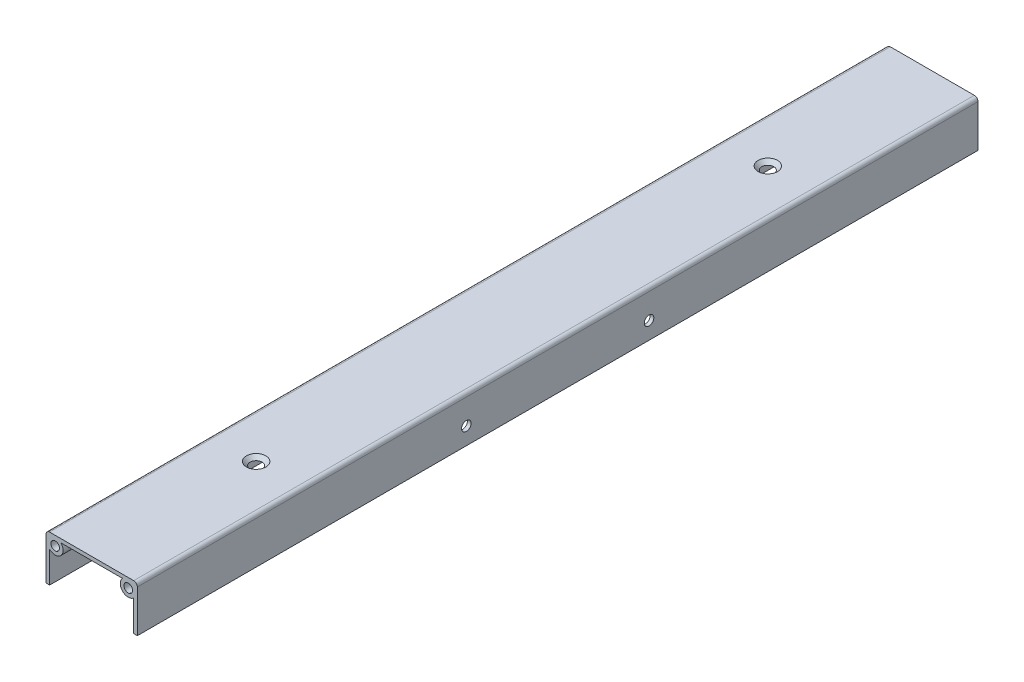
from build123d import *

# Parameters (mm, degrees)
SKETCH1_W                                            = 63.5
SKETCH1_H                                            = 63.5
SKETCH1_R                                            = 3
BOSS_EXTRUDE1_DEPTH                                  = 292.1
FILLET1_R                                            = 2.54
SHELL1_START                                         = -292.1
SHELL1_DEPTH                                         = 584.2
SKETCH3_W                                            = 63.665273771
SKETCH3_H                                            = 31.75
CUT_EXTRUDE2_DEPTH                                   = 586.923002621
CSK_FOR_M6_HEX_SOCKET_COUNTERSUNK_HEAD_S_D           = 6.4
CSK_FOR_M6_HEX_SOCKET_COUNTERSUNK_HEAD_S_CSINK_D     = 13.5
CSK_FOR_M6_HEX_SOCKET_COUNTERSUNK_HEAD_S_CSINK_ANGLE = 90
M6_CLEARANCE_HOLE1_D                                 = 6.6
M6_CLEARANCE_HOLE1_DEPTH                             = 2.54


# Read off the part's stored shape, not the designer's step: Shell1
with BuildPart() as part:
    # Sketch1 → Boss-Extrude1 (new, symmetric)
    with BuildSketch(Plane.XY):
        Rectangle(SKETCH1_W, SKETCH1_H)
        with Locations((-25.4, 25.4)):
            Circle(SKETCH1_R, mode=Mode.SUBTRACT)
        with Locations(Location((25.4, -25.4, 0), (0, 0, 180))):
            Circle(SKETCH1_R, mode=Mode.SUBTRACT)
        with Locations(Location((-25.4, -25.4, 0), (0, 0, 180))):
            Circle(SKETCH1_R, mode=Mode.SUBTRACT)
        with Locations(Location((25.4, 25.4, 0), (0, 0, 180))):
            Circle(SKETCH1_R, mode=Mode.SUBTRACT)
    extrude(amount=BOSS_EXTRUDE1_DEPTH, both=True)

    # Fillet1
    fillet1_edges = [part.edges().sort_by_distance(p)[0] for p in [
        (31.75, -31.75, 0),
        (-31.75, -31.75, 0),
        (-31.75, 31.75, 0),
        (31.75, 31.75, 0),
    ]]
    fillet(fillet1_edges, radius=FILLET1_R)

    # Shell1 outline → Shell1 (cut)
    with BuildSketch(Plane.XY.offset(SHELL1_START)):
        with BuildLine():
            Line((29.21, -21.378122329), (29.21, 21.378122329))
            ThreePointArc((29.21, 21.378122329), (21.482628432, 21.482628432), (21.378122329, 29.21))
            Line((21.378122329, 29.21), (-21.378122329, 29.21))
            ThreePointArc((-21.378122329, 29.21), (-21.482628432, 21.482628432), (-29.21, 21.378122329))
            Line((-29.21, 21.378122329), (-29.21, -21.378122329))
            ThreePointArc((-29.21, -21.378122329), (-21.482628432, -21.482628432), (-21.378122329, -29.21))
            Line((-21.378122329, -29.21), (21.378122329, -29.21))
            ThreePointArc((21.378122329, -29.21), (21.482628432, -21.482628432), (29.21, -21.378122329))
        make_face()
    extrude(amount=SHELL1_DEPTH, mode=Mode.SUBTRACT)

    # Sketch3 → Cut-Extrude2 (cut, through all)
    with BuildSketch(Plane.XY.offset(292.1)):
        with Locations((0.082636885, -16.003852467)):
            Rectangle(SKETCH3_W, SKETCH3_H)
    extrude(amount=-CUT_EXTRUDE2_DEPTH, mode=Mode.SUBTRACT)

    # CSK for M6 Hex Socket Countersunk Head Screw1 (through all)
    with Locations(Plane(origin=(0, 31.75, 0), x_dir=(1, 0, 0), z_dir=(0, 1, 0))):
        with Locations((0, 177.8), (0, -177.8)):
            CounterSinkHole(CSK_FOR_M6_HEX_SOCKET_COUNTERSUNK_HEAD_S_D / 2, CSK_FOR_M6_HEX_SOCKET_COUNTERSUNK_HEAD_S_CSINK_D / 2, counter_sink_angle=CSK_FOR_M6_HEX_SOCKET_COUNTERSUNK_HEAD_S_CSINK_ANGLE)

    # M6 Clearance Hole1
    with Locations(Plane(origin=(31.75, 0, 0), x_dir=(0, 0, -1), z_dir=(1, 0, 0))):
        with Locations((63.5, 11.811849331), (-63.5, 11.811849331)):
            Hole(M6_CLEARANCE_HOLE1_D / 2, depth=M6_CLEARANCE_HOLE1_DEPTH)


solid = part.part
